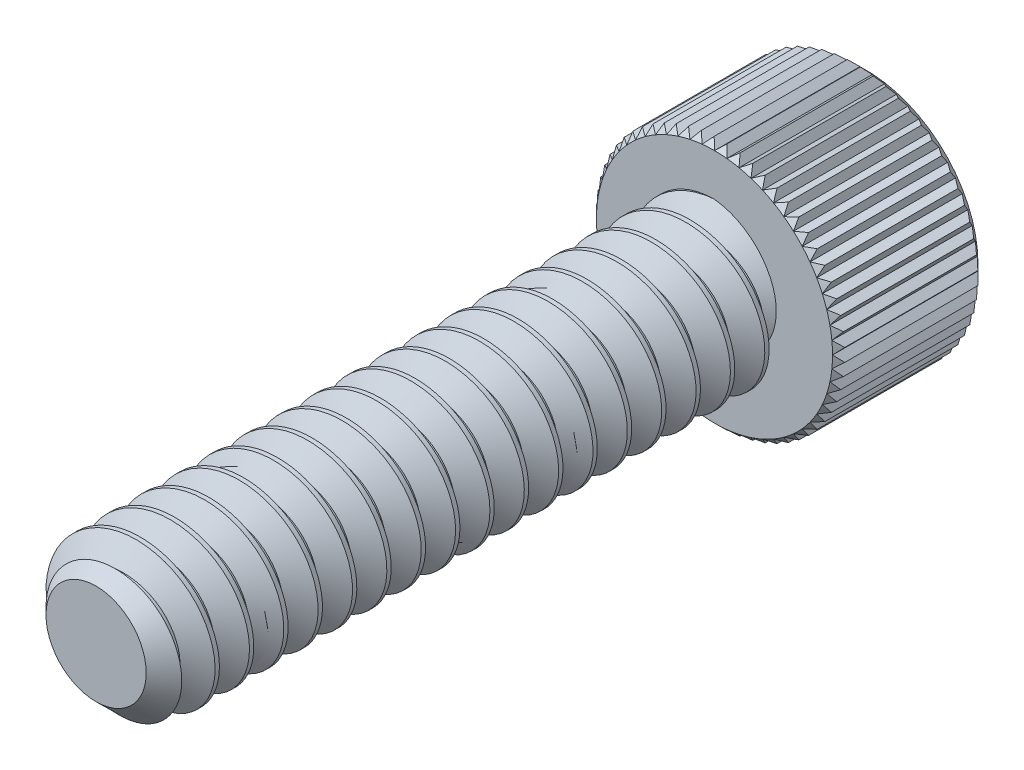
from build123d import *
from build123d.topology import SkipClean

# Parameters (mm, degrees)
SKETCH1_R          = 1.7526
EXTRUDE1_DEPTH     = 14.2875
CHAMFER3_SIZE      = 0.5953125
CUT_SWEEP1_PITCH   = 0.79375
SKETCH6_R          = 2.8702
EXTRUDE2_DEPTH     = 3.5052
CUT_EXTRUDE1_DEPTH = 2.08359375
CHAMFER1_SIZE      = 0.28702
CHAMFER2_SIZE      = 0.14351
CUT_EXTRUDE3_DEPTH = 15.852903931
CIRPATTERN1_COUNT  = 60


with BuildPart() as part:
    # Sketch1 → Extrude1 (new body)
    with BuildSketch(Plane.XY):
        Circle(SKETCH1_R)
    extrude(amount=-EXTRUDE1_DEPTH)

    # Chamfer3
    chamfer3_edges = [part.edges().sort_by_distance(p)[0] for p in [
        (-1.7526, 0, 0),
    ]]
    chamfer(chamfer3_edges, length=CHAMFER3_SIZE)

    # Cut-Sweep1: the profile of Sketch3 profile screwed along a right-hand helix of 19 turns, 6 arcs to a turn; built about Z, then put on its axis
    cut_sweep1_z = Axis((0, 0, 0), (0, 0, 1))
    cut_sweep1_corners = [(1.7529, 0, -0.694704455), (1.237044252, 0, -0.396875), (1.237044252, 0, -0.29765625), (1.7529, 0, 0.000173205)]
    with BuildLine(mode=Mode.PRIVATE) as cut_sweep1_profile:
        Line(cut_sweep1_corners[0], cut_sweep1_corners[1])
        Line(cut_sweep1_corners[1], cut_sweep1_corners[2])
        Line(cut_sweep1_corners[2], cut_sweep1_corners[3])
        Line(cut_sweep1_corners[3], cut_sweep1_corners[0])
    cut_sweep1_cap = Face(cut_sweep1_profile.wire())
    cut_sweep1_turn_angles = [0, 30, 60, 90, 120, 150, 180, 210, 240, 270, 300, 330, 360]
    cut_sweep1_turn_weights = [1, 0.8660254037844387, 1, 0.8660254037844387, 1, 0.8660254037844387, 1, 0.8660254037844387, 1, 0.8660254037844387, 1, 0.8660254037844387, 1]
    cut_sweep1_turn_rails = [Edge.make_bspline([Vector(p[0], p[1], 0).rotate(cut_sweep1_z, cut_sweep1_turn_angles[k]) / cut_sweep1_turn_weights[k] + Vector(0, 0, p[2] + CUT_SWEEP1_PITCH * cut_sweep1_turn_angles[k] / 360) for k in range(13)], [0, 0, 0, 1, 1, 2, 2, 3, 3, 4, 4, 5, 5, 6, 6, 6], 2, cut_sweep1_turn_weights) for p in cut_sweep1_corners]
    cut_sweep1_turn_sides = [Face.make_surface_from_curves(cut_sweep1_turn_rails[p[0]], cut_sweep1_turn_rails[p[1]]) for p in [(0, 1), (1, 2), (2, 3), (3, 0)]]
    cut_sweep1 = Plane(origin=(0, 0, 0), x_dir=(0, 1, 0), z_dir=(0, 0, -1)) * Solid(Shell([*[p.moved(Location((0, 0, CUT_SWEEP1_PITCH * i))) for i in range(19) for p in cut_sweep1_turn_sides], cut_sweep1_cap, cut_sweep1_cap.rotate(cut_sweep1_z, 6840).moved(Location((0, 0, CUT_SWEEP1_PITCH * 6840 / 360)))]))
    add(cut_sweep1, mode=Mode.SUBTRACT)

    # Sketch6 → Extrude2 (add)
    with BuildSketch(Plane(origin=(0, 0, -14.2875), x_dir=(-1, 0, 0), z_dir=(0, 0, -1))):
        Circle(SKETCH6_R)
    extrude(amount=EXTRUDE2_DEPTH)

    # Sketch7 → Cut-Extrude1 (cut)
    with BuildSketch(Plane(origin=(0, 0, -17.7927), x_dir=(-1, 0, 0), z_dir=(0, 0, -1))):
        Polygon((0, 1.603951217), (-1.3890625, 0.801975608), (-1.3890625, -0.801975608), (0, -1.603951217), (1.3890625, -0.801975608), (1.3890625, 0.801975608), align=None)
    extrude(amount=-CUT_EXTRUDE1_DEPTH, mode=Mode.SUBTRACT)

    # Cut-Extrude2 cone 1 section (through the dimple's axis) → Cut-Extrude2 (revolve, cut)
    with BuildSketch(Plane(origin=(0, 0, -17.7927), x_dir=(0, 1, 0), z_dir=(1, 0, 0))):
        Polygon((0, 0), (1.603951217, 0), (0, 1.603951217), align=None)
    revolve(axis=Axis((0, 0, -17.7927), (0, 0, 1)), mode=Mode.SUBTRACT)

    # Chamfer1
    chamfer1_edges = [part.edges().sort_by_distance(p)[0] for p in [
        (2.8702, 0, -17.7927),
    ]]
    chamfer(chamfer1_edges, length=CHAMFER1_SIZE)

    # Chamfer2
    chamfer2_edges = [part.edges().sort_by_distance(p)[0] for p in [
        (2.8702, 0, -14.2875),
    ]]
    chamfer(chamfer2_edges, length=CHAMFER2_SIZE)

    # Sketch10 → Cut-Extrude3 (cut, through all)
    with SkipClean():  # the faces are left unmerged after this step: merging them gives an invalid solid
        with BuildSketch(Plane.XY.offset(-14.2875)):
            Polygon((-0.308895946, 3.01371), (0, 2.72669), (0.308895946, 3.01371), align=None)
        cut_extrude3 = extrude(amount=-CUT_EXTRUDE3_DEPTH, mode=Mode.SUBTRACT)

    # CirPattern1: Cut-Extrude3 ×60 about axis
    cirpattern1_axis = Axis((0, 0, 0), (0, 0, 1))
    for i in range(1, CIRPATTERN1_COUNT):
        add(cut_extrude3.rotate(cirpattern1_axis, i * 360 / CIRPATTERN1_COUNT), mode=Mode.SUBTRACT)


solid = part.part
